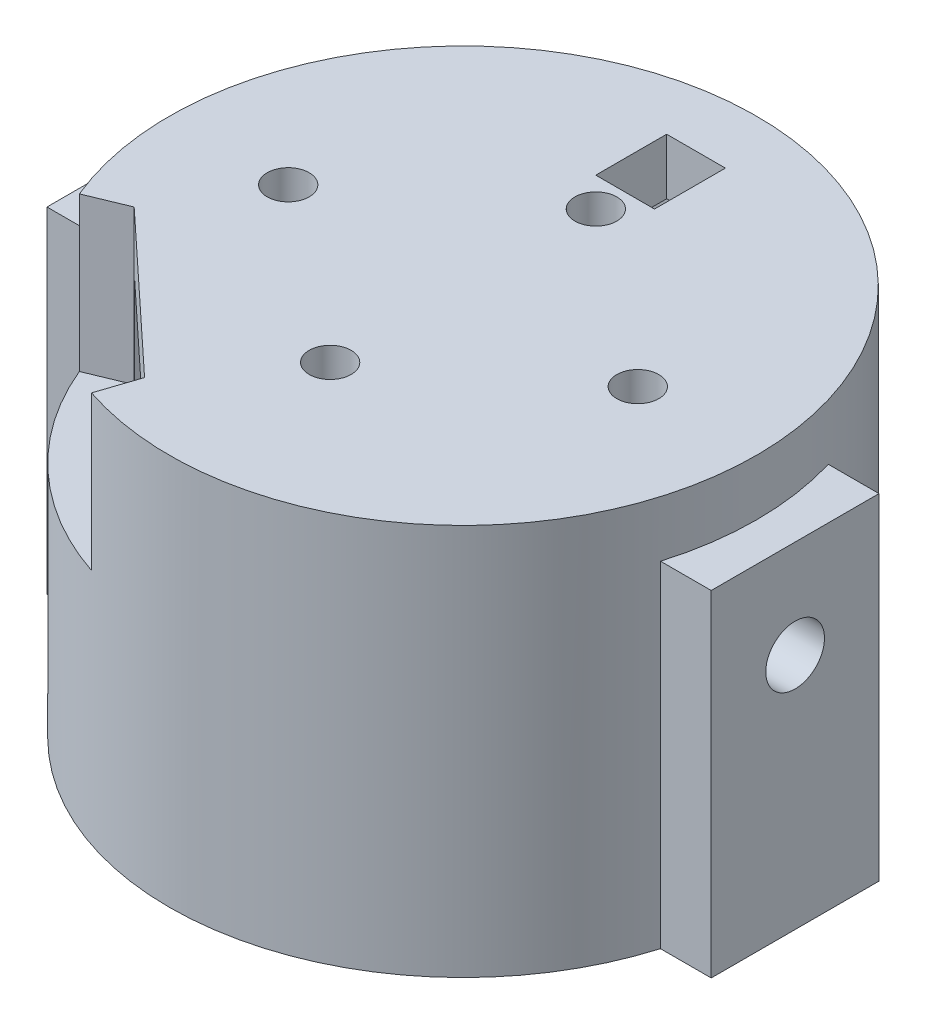
from build123d import *

# Parameters (mm, degrees)
SKETCH1_R           = 21
SKETCH1_R_2         = 17.75
BOSS_EXTRUDE2_DEPTH = 12
SKETCH5_W           = 6
SKETCH5_H           = 12
BOSS_EXTRUDE7_DEPTH = 12
SKETCH6_W           = 6
SKETCH6_H           = 12
BOSS_EXTRUDE8_DEPTH = 12
BOSS_EXTRUDE9_START = 4
SKETCH8_R           = 21
BOSS_EXTRUDE9_DEPTH = 4
CUT_EXTRUDE2_REACH  = 44.297
SKETCH9_R           = 1.5
CUT_EXTRUDE6_START  = 5
CUT_EXTRUDE6_DEPTH  = 31.511441818
SKETCH13_R          = 2.1
CUT_EXTRUDE7_DEPTH  = 55.343812895
SKETCH14_W          = 4.2
SKETCH14_H          = 5.071124023
CUT_EXTRUDE9_DEPTH  = 10


with BuildPart() as part:
    # Sketch1 → Boss-Extrude2 (new, symmetric)
    with BuildSketch(Plane(origin=(0, 0, 0), x_dir=(1, 0, 0), z_dir=(0, 1, 0))):
        Circle(SKETCH1_R)
        Circle(SKETCH1_R_2, mode=Mode.SUBTRACT)
    extrude(amount=BOSS_EXTRUDE2_DEPTH, both=True)

    # Sketch6 → Boss-Extrude8 (add, symmetric)
    with BuildSketch(Plane(origin=(0, 0, 0), x_dir=(1, 0, 0), z_dir=(0, 1, 0))):
        with Locations((-20.75, 0)):
            Rectangle(SKETCH6_W, SKETCH6_H)
    extrude(amount=BOSS_EXTRUDE8_DEPTH, both=True)



with BuildPart() as body_2:
    # Sketch5 → Boss-Extrude7 (new, symmetric)
    with BuildSketch(Plane(origin=(0, 0, 0), x_dir=(1, 0, 0), z_dir=(0, 1, 0))):
        with Locations((20.75, 0)):
            Rectangle(SKETCH5_W, SKETCH5_H)
    extrude(amount=BOSS_EXTRUDE7_DEPTH, both=True)


with BuildPart() as part_1:
    add(part.part)

    add(body_2.part)  # Boss-Extrude9 merges body 2
    # Sketch8 → Boss-Extrude9 (add)
    with BuildSketch(Plane(origin=(0, 12, 0), x_dir=(1, 0, 0), z_dir=(0, 1, 0)).offset(BOSS_EXTRUDE9_START)):
        Circle(SKETCH8_R)
    extrude(amount=-BOSS_EXTRUDE9_DEPTH)

    # Sketch9 → Cut-Extrude2 (cut, up to next)
    with BuildSketch(Plane(origin=(0, 16, 0), x_dir=(1, 0, 0), z_dir=(0, 1, 0)), mode=Mode.PRIVATE) as cut_extrude2_sk1:
        with Locations((0, 9.5)):
            Circle(SKETCH9_R)
    cut_extrude2_tool1 = extrude(cut_extrude2_sk1.sketch, amount=-CUT_EXTRUDE2_REACH, mode=Mode.PRIVATE) & part_1.part
    # Sketch9 → Cut-Extrude2 (cut, up to next)
    with BuildSketch(Plane(origin=(0, 16, 0), x_dir=(1, 0, 0), z_dir=(0, 1, 0)), mode=Mode.PRIVATE) as cut_extrude2_sk2:
        with Locations((0, -9.5)):
            Circle(SKETCH9_R)
    cut_extrude2_tool2 = extrude(cut_extrude2_sk2.sketch, amount=-CUT_EXTRUDE2_REACH, mode=Mode.PRIVATE) & part_1.part
    # Sketch9 → Cut-Extrude2 (cut, up to next)
    with BuildSketch(Plane(origin=(0, 16, 0), x_dir=(1, 0, 0), z_dir=(0, 1, 0)), mode=Mode.PRIVATE) as cut_extrude2_sk3:
        with Locations((-12.5, 0)):
            Circle(SKETCH9_R)
    cut_extrude2_tool3 = extrude(cut_extrude2_sk3.sketch, amount=-CUT_EXTRUDE2_REACH, mode=Mode.PRIVATE) & part_1.part
    # Sketch9 → Cut-Extrude2 (cut, up to next)
    with BuildSketch(Plane(origin=(0, 16, 0), x_dir=(1, 0, 0), z_dir=(0, 1, 0)), mode=Mode.PRIVATE) as cut_extrude2_sk4:
        with Locations((12.5, 0)):
            Circle(SKETCH9_R)
    cut_extrude2_tool4 = extrude(cut_extrude2_sk4.sketch, amount=-CUT_EXTRUDE2_REACH, mode=Mode.PRIVATE) & part_1.part
    add(cut_extrude2_tool1.solids().sort_by_distance((0, 16, -9.5))[0], mode=Mode.SUBTRACT)
    add(cut_extrude2_tool2.solids().sort_by_distance((0, 16, 9.5))[0], mode=Mode.SUBTRACT)
    add(cut_extrude2_tool3.solids().sort_by_distance((-12.5, 16, 0))[0], mode=Mode.SUBTRACT)
    add(cut_extrude2_tool4.solids().sort_by_distance((12.5, 16, 0))[0], mode=Mode.SUBTRACT)

    # Sketch12 → Cut-Extrude6 (cut, through all)
    with BuildSketch(Plane(origin=(0, 0, 0), x_dir=(1, 0, 0), z_dir=(0, 1, 0)).offset(CUT_EXTRUDE6_START)):
        with BuildLine():
            Line((-19.403691202, -8.030987969), (-16.631735316, -6.883703973))
            Line((-16.631735316, -6.883703973), (-5.696415073, -17.074860331))
            Line((-5.696415073, -17.074860331), (-6.645817585, -19.920670386))
            ThreePointArc((-6.645817585, -19.920670386), (-14.317309943, -15.36276785), (-19.403691202, -8.030987969))
        make_face()
    extrude(amount=CUT_EXTRUDE6_DEPTH, mode=Mode.SUBTRACT)

    # Sketch13 → Cut-Extrude7 (cut, through all)
    with BuildSketch(Plane.ZY.offset(23.75)):
        with Locations((0, 5)):
            Circle(SKETCH13_R)
    extrude(amount=-CUT_EXTRUDE7_DEPTH, mode=Mode.SUBTRACT)

    # Sketch14 → Cut-Extrude9 (cut)
    with BuildSketch(Plane(origin=(0, 16, 0), x_dir=(1, 0, 0), z_dir=(0, 1, 0))):
        with Locations((0, 14.128980771)):
            Rectangle(SKETCH14_W, SKETCH14_H)
    extrude(amount=-CUT_EXTRUDE9_DEPTH, mode=Mode.SUBTRACT)


solid = part_1.part
